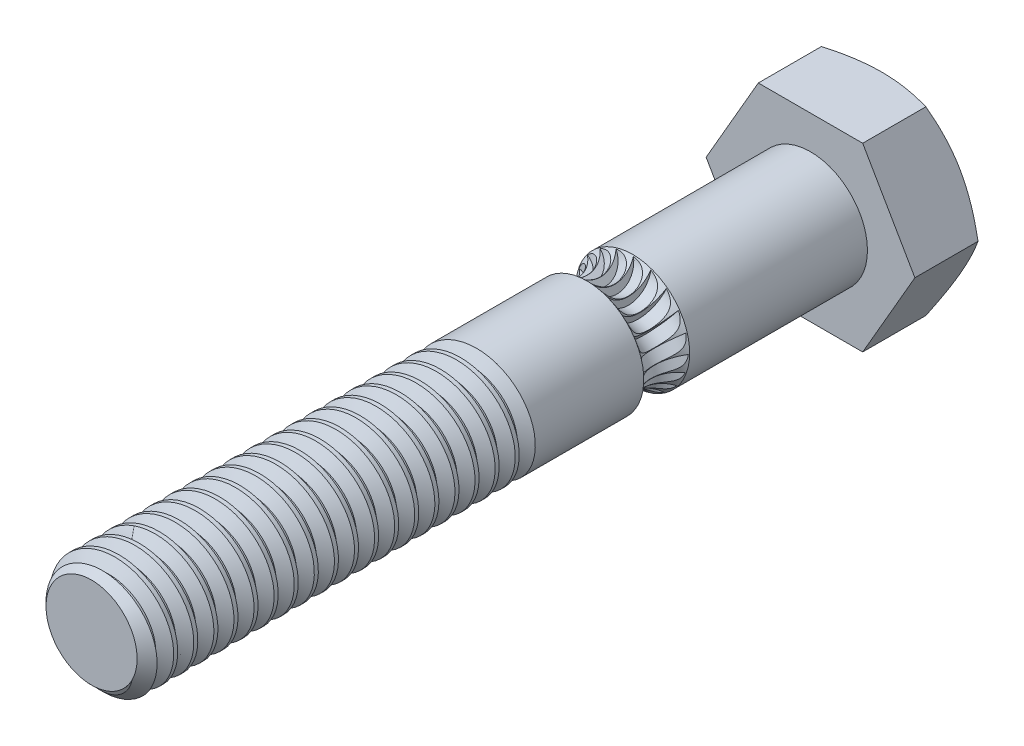
from build123d import *

# Parameters (mm, degrees)
SKETCH1_R          = 4
BOLT_BODY_DEPTH    = 50.5
SKETCH9_R          = 1.984375
BOLT_HEAD_DEPTH    = 5
CUT_EXTRUDE2_START = 1.31
SKETCH5_R          = 1.5875
CUT_EXTRUDE2_DEPTH = 51.113106026
CIRPATTERN1_COUNT  = 20
CHAMFER1_SIZE      = 0.8
SKETCH6_OUTSIDE_W  = 63.064
SKETCH6_OUTSIDE_H  = 61.1
SKETCH6_OUTSIDE_R  = 6.35
CUT_EXTRUDE3_DEPTH = 10
CUT_EXTRUDE3_DRAFT = -60
CUT_SWEEP1_PITCH   = 1.411111111


with BuildPart() as part:
    # Sketch1 → Bolt Body (new body)
    with BuildSketch(Plane.XY):
        Circle(SKETCH1_R)
    extrude(amount=BOLT_BODY_DEPTH)

    # Sketch9 → Cut-Revolve1 (revolve, cut)
    with BuildSketch(Plane(origin=(0, 0, 0), x_dir=(0, 0, -1), z_dir=(1, 0, 0)), mode=Mode.PRIVATE) as cut_revolve1_sk:
        with Locations((-14.1, 5.159375)):
            Circle(SKETCH9_R)
    revolve(cut_revolve1_sk.sketch.rotate(Axis((0, 0, -10.381222937), (0, 0, 1)), 90), axis=Axis((0, 0, -10.381222937), (0, 0, 1)), mode=Mode.SUBTRACT)

    # Sketch3 → Bolt Head (add)
    with BuildSketch(Plane.XY):
        Polygon((7.332348419, 0), (3.666174209, 6.35), (-3.666174209, 6.35), (-7.332348419, 0), (-3.666174209, -6.35), (3.666174209, -6.35), align=None)
    extrude(amount=-BOLT_HEAD_DEPTH)

    # Sketch5 → Cut-Extrude2 (cut, through all)
    with BuildSketch(Plane(origin=(0, 0, 0), x_dir=(1, 0, 0), z_dir=(0, 1, 0)).offset(CUT_EXTRUDE2_START)):
        with Locations((-3.95, -14.1)):
            Circle(SKETCH5_R)
    cut_extrude2 = extrude(amount=CUT_EXTRUDE2_DEPTH, mode=Mode.SUBTRACT)

    # CirPattern1: Cut-Extrude2 ×20 about axis
    cirpattern1_axis = Axis((0, 0, 0), (0, 0, 1))
    for i in range(1, CIRPATTERN1_COUNT):
        add(cut_extrude2.rotate(cirpattern1_axis, i * 360 / CIRPATTERN1_COUNT), mode=Mode.SUBTRACT)

    # Chamfer1
    chamfer1_edges = [part.edges().sort_by_distance(p)[0] for p in [
        (-4, 0, 50.5),
    ]]
    chamfer(chamfer1_edges, length=CHAMFER1_SIZE)


with BuildPart() as cut_extrude3_tool:
    # Sketch6 outside → Cut-Extrude3 (with draft: the straight prism first)
    with BuildSketch(Plane(origin=(0, 0, -5), x_dir=(-1, 0, 0), z_dir=(0, 0, -1))):
        Rectangle(SKETCH6_OUTSIDE_W, SKETCH6_OUTSIDE_H)
        Circle(SKETCH6_OUTSIDE_R, mode=Mode.SUBTRACT)
    extrude(amount=-CUT_EXTRUDE3_DEPTH)
    # Cut-Extrude3: the draft: its side faces are tilted about the plane it starts from
    cut_extrude3_sides = [cut_extrude3_tool.faces().sort_by_distance(p)[0] for p in [
        (0, -30.55, 0),
        (-31.532, 0, 0),
        (0, 30.55, 0),
        (31.532, 0, 0),
        (6.35, 0, 0),
    ]]
    draft(cut_extrude3_sides, Plane(origin=(0, 0, -5), x_dir=(-1, 0, 0), z_dir=(0, 0, -1)), CUT_EXTRUDE3_DRAFT)


with BuildPart() as part_1:
    add(part.part)

    # Cut-Extrude3: cut by cut_extrude3_tool
    add(cut_extrude3_tool.part, mode=Mode.SUBTRACT)

    # Cut-Sweep1: arcs per turn and ends read off the stored shape
    # Cut-Sweep1: the profile of Sketch7 profile screwed along a right-hand helix through 20 turns, 8 arcs to a turn; built about Z, then put on its axis
    cut_sweep1_z = Axis((0, 0, 0), (0, 0, 1))
    cut_sweep1_corners = [(4.0003, 0, -0.352604573), (3.2, 0, -0.814657993), (3.2, 0, -1.019786451), (4.0003, 0, -1.481839872)]
    with BuildLine(mode=Mode.PRIVATE) as cut_sweep1_profile:
        Line(cut_sweep1_corners[0], cut_sweep1_corners[1])
        Line(cut_sweep1_corners[1], cut_sweep1_corners[2])
        Line(cut_sweep1_corners[2], cut_sweep1_corners[3])
        Line(cut_sweep1_corners[3], cut_sweep1_corners[0])
    cut_sweep1_cap = Face(cut_sweep1_profile.wire())
    cut_sweep1_turn_angles = [0, 22.5, 45, 67.5, 90, 112.5, 135, 157.5, 180, 202.5, 225, 247.5, 270, 292.5, 315, 337.5, 360]
    cut_sweep1_turn_weights = [1, 0.9238795325112867, 1, 0.9238795325112867, 1, 0.9238795325112867, 1, 0.9238795325112867, 1, 0.9238795325112867, 1, 0.9238795325112867, 1, 0.9238795325112867, 1, 0.9238795325112867, 1]
    cut_sweep1_turn_rails = [Edge.make_bspline([Vector(p[0], p[1], 0).rotate(cut_sweep1_z, cut_sweep1_turn_angles[k]) / cut_sweep1_turn_weights[k] + Vector(0, 0, p[2] + CUT_SWEEP1_PITCH * cut_sweep1_turn_angles[k] / 360) for k in range(17)], [0, 0, 0, 1, 1, 2, 2, 3, 3, 4, 4, 5, 5, 6, 6, 7, 7, 8, 8, 8], 2, cut_sweep1_turn_weights) for p in cut_sweep1_corners]
    cut_sweep1_turn_sides = [Face.make_surface_from_curves(cut_sweep1_turn_rails[p[0]], cut_sweep1_turn_rails[p[1]]) for p in [(0, 1), (1, 2), (2, 3), (3, 0)]]
    cut_sweep1 = Plane(origin=(0, 0, 50.5), x_dir=(-1, 0, 0), z_dir=(0, 0, -1)) * Solid(Shell([*[p.moved(Location((0, 0, CUT_SWEEP1_PITCH * i))) for i in range(20) for p in cut_sweep1_turn_sides], cut_sweep1_cap, cut_sweep1_cap.rotate(cut_sweep1_z, 7200).moved(Location((0, 0, CUT_SWEEP1_PITCH * 7200 / 360)))]))
    add(cut_sweep1, mode=Mode.SUBTRACT)


solid = part_1.part
